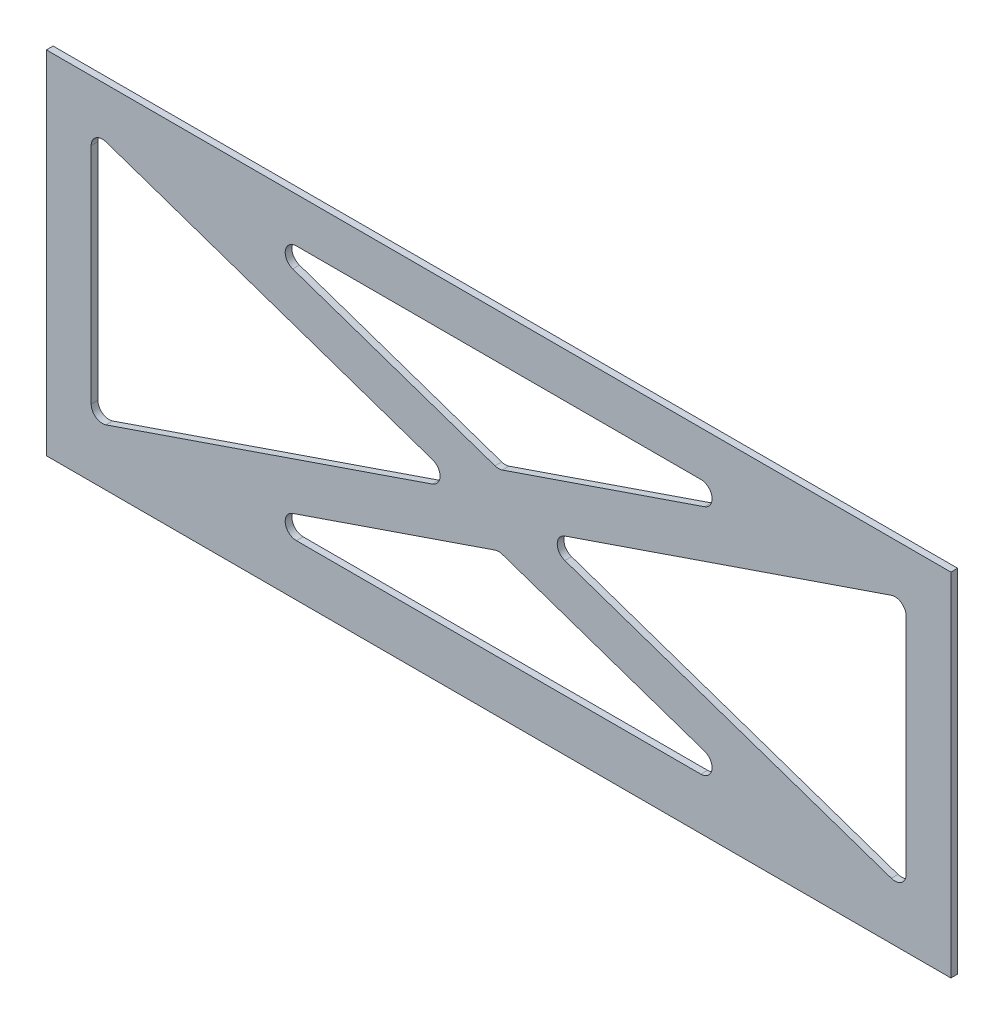
from build123d import *

# Parameters (mm, degrees)
SKETCH1_W           = 404
SKETCH1_H           = 157
BOSS_EXTRUDE1_DEPTH = 3


with BuildPart() as part:
    # Sketch1 → Boss-Extrude1 (new body)
    with BuildSketch(Plane.XY.offset(152)):
        with Locations((134.5, -10.5)):
            Rectangle(SKETCH1_W, SKETCH1_H)
        with BuildLine():
            Line((-47.5, -59.000071616), (-47.5, 41.000071616))
            ThreePointArc((-47.5, 41.000071616), (-45.406210657, 45.068724909), (-40.878424152, 45.72981704))
            Line((-40.878424152, 45.72981704), (104.959718578, -4.270254577))
            ThreePointArc((104.959718578, -4.270254577), (108.33814273, -9), (104.959718578, -13.729745423))
            Line((104.959718578, -13.729745423), (-40.878424152, -63.72981704))
            ThreePointArc((-40.878424152, -63.72981704), (-45.406210657, -63.068724909), (-47.5, -59.000071616))
        make_face(mode=Mode.SUBTRACT)
        with BuildLine():
            Line((224.830697362, 48), (44.169302638, 48))
            ThreePointArc((44.169302638, 48), (39.237329041, 43.821971071), (42.54772679, 38.270254577))
            Line((42.54772679, 38.270254577), (132.878424152, 7.300706743))
            ThreePointArc((132.878424152, 7.300706743), (134.5, 7.030452166), (136.121575848, 7.300706743))
            Line((136.121575848, 7.300706743), (226.45227321, 38.270254577))
            ThreePointArc((226.45227321, 38.270254577), (229.762670959, 43.821971071), (224.830697362, 48))
        make_face(mode=Mode.SUBTRACT)
        with BuildLine():
            Line((309.878424152, 45.72981704), (164.040281422, -4.270254577))
            ThreePointArc((164.040281422, -4.270254577), (160.66185727, -9), (164.040281422, -13.729745423))
            Line((164.040281422, -13.729745423), (309.878424152, -63.72981704))
            ThreePointArc((309.878424152, -63.72981704), (314.406210657, -63.068724909), (316.5, -59.000071616))
            Line((316.5, -59.000071616), (316.5, 41.000071616))
            ThreePointArc((316.5, 41.000071616), (314.406210657, 45.068724909), (309.878424152, 45.72981704))
        make_face(mode=Mode.SUBTRACT)
        with BuildLine():
            Line((42.54772679, -56.270254577), (132.878424152, -25.300706743))
            ThreePointArc((132.878424152, -25.300706743), (134.5, -25.030452166), (136.121575848, -25.300706743))
            Line((136.121575848, -25.300706743), (226.45227321, -56.270254577))
            ThreePointArc((226.45227321, -56.270254577), (229.762670959, -61.821971071), (224.830697362, -66))
            Line((224.830697362, -66), (44.169302638, -66))
            ThreePointArc((44.169302638, -66), (39.237329041, -61.821971071), (42.54772679, -56.270254577))
        make_face(mode=Mode.SUBTRACT)
    extrude(amount=BOSS_EXTRUDE1_DEPTH)


solid = part.part
